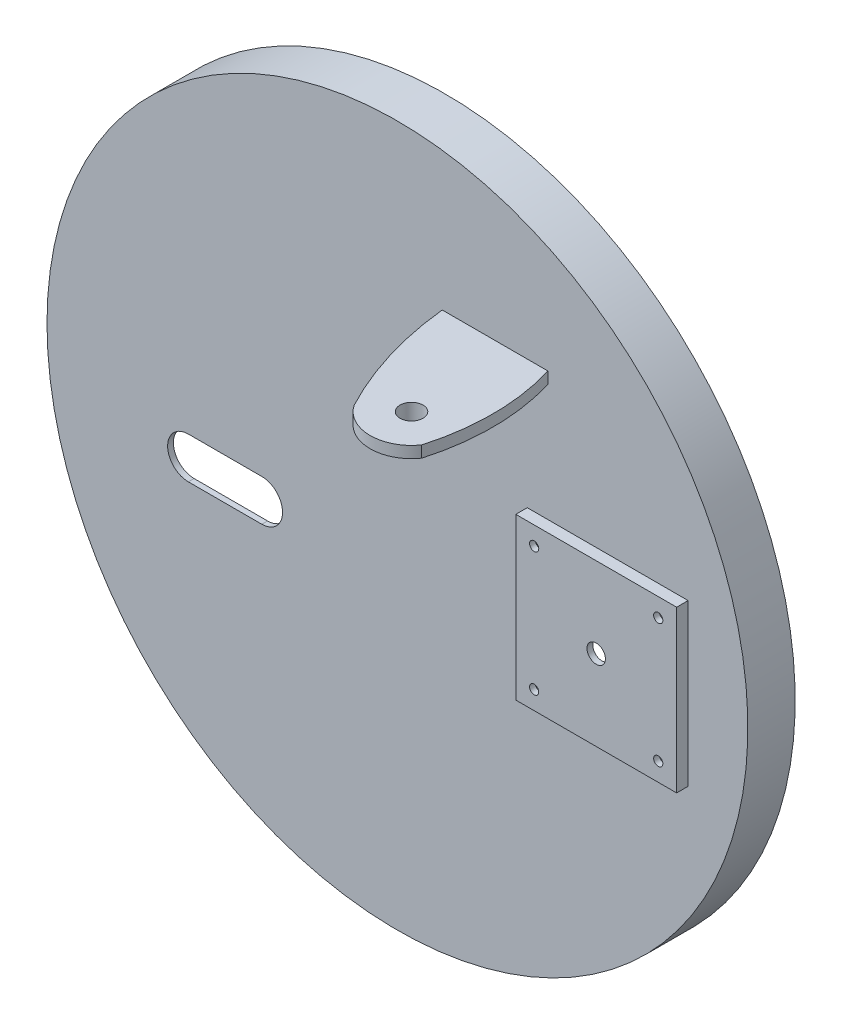
from build123d import *

# Parameters (mm, degrees)
SKETCH_1_R           = 305
EXTRUDE_1_DEPTH      = 41.2
SKETCH_2_W           = 140
SKETCH_2_H           = 140
EXTRUDE_2_DEPTH      = 10
SHELL_1_T            = -5
CUT_EXTRUDE_9_DEPTH  = 100
SKETCH_5_W           = 120
SKETCH_5_H           = 10
EXTRUDE_3_DEPTH      = 150
CUT_EXTRUDE_10_DEPTH = 150
SKETCH_10_R          = 10
CUT_EXTRUDE_11_DEPTH = 150
EXTRUDE_START        = 10
SKETCH_11_R          = 20
SKETCH_11_R_2        = 10
EXTRUDE_4_DEPTH      = 10
SKETCH_18_R          = 85
EXTRUDE_7_DEPTH      = 30
SKETCH_19_R          = 75
CUT_EXTRUDE_12_DEPTH = 30
SKETCH_21_R          = 4
SKETCH_21_R_2        = 8
CUT_EXTRUDE_13_DEPTH = 30


with BuildPart() as part:
    # 草图1 → 凸台-拉伸1 (new body)
    with BuildSketch(Plane.XY):
        Circle(SKETCH_1_R)
    extrude(amount=EXTRUDE_1_DEPTH)

    # 草图2 → 凸台-拉伸2 (add)
    with BuildSketch(Plane.XY.offset(41.2)):
        with Locations((183, 0)):
            Rectangle(SKETCH_2_W, SKETCH_2_H)
    extrude(amount=EXTRUDE_2_DEPTH)

    # 抽壳1
    shell_1_openings = [part.faces().sort_by_distance(p)[0] for p in [
        (0, 0, 0),
    ]]
    offset(amount=SHELL_1_T, openings=shell_1_openings, kind=Kind.INTERSECTION)

    # 草图4 → 切除-拉伸9 (cut)
    with BuildSketch(Plane.XY):
        with BuildLine():
            Line((-182, -22), (-118, -22))
            ThreePointArc((-118, -22), (-100, -40), (-118, -58))
            Line((-118, -58), (-182, -58))
            ThreePointArc((-182, -58), (-200, -40), (-182, -22))
        make_face()
    extrude(amount=CUT_EXTRUDE_9_DEPTH, mode=Mode.SUBTRACT)

    # 草图5 → 凸台-拉伸3 (add)
    with BuildSketch(Plane.XY.offset(41.2)):
        with Locations((99, 177.019414693)):
            Rectangle(SKETCH_5_W, SKETCH_5_H)
    extrude(amount=EXTRUDE_3_DEPTH)

    # 草图9 → 切除-拉伸10 (cut)
    with BuildSketch(Plane.XZ.offset(-172.019414693)):
        with BuildLine():
            Line((159, 191.2), (39, 191.2))
            Line((39, 191.2), (39, 41.2))
            ThreePointArc((39, 41.2), (50.403223503, 97.919506773), (72.48168386, 151.395459716))
            ThreePointArc((72.48168386, 151.395459716), (95.641745104, 166.582031742), (122.732592827, 160.828217675))
            ThreePointArc((122.732592827, 160.828217675), (127.644425669, 156.750329387), (131.758731658, 151.868960626))
            ThreePointArc((131.758731658, 151.868960626), (139.395350951, 96.479523786), (131, 41.2))
            Line((131, 41.2), (159, 41.2))
            Line((159, 41.2), (159, 191.2))
        make_face()
    extrude(amount=-CUT_EXTRUDE_10_DEPTH, mode=Mode.SUBTRACT)

    # 草图10 → 切除-拉伸11 (cut)
    with BuildSketch(Plane.XZ.offset(-172.019414693)):
        with Locations((102.283418824, 131.2)):
            Circle(SKETCH_10_R)
    extrude(amount=-CUT_EXTRUDE_11_DEPTH, mode=Mode.SUBTRACT)

    # 草图11 → 凸台-拉伸4 (add)
    with BuildSketch(Plane.XZ.offset(-172.019414693).offset(EXTRUDE_START)):
        with Locations((102.283418824, 131.2)):
            Circle(SKETCH_11_R)
        with Locations((102.283418824, 131.2)):
            Circle(SKETCH_11_R_2, mode=Mode.SUBTRACT)
    extrude(amount=-EXTRUDE_4_DEPTH)

    # 草图18 → 凸台-拉伸7 (add)
    with BuildSketch(Plane(origin=(0, 0, 36.2), x_dir=(-1, 0, 0), z_dir=(0, 0, -1))):
        Circle(SKETCH_18_R)
    extrude(amount=EXTRUDE_7_DEPTH)

    # 草图19 → 切除-拉伸12 (cut)
    with BuildSketch(Plane(origin=(0, 0, 6.2), x_dir=(-1, 0, 0), z_dir=(0, 0, -1))):
        Circle(SKETCH_19_R)
    extrude(amount=-CUT_EXTRUDE_12_DEPTH, mode=Mode.SUBTRACT)

    # 草图21 → 切除-拉伸13 (cut)
    with BuildSketch(Plane.XY.offset(51.2)):
        with Locations((237, 54)):
            Circle(SKETCH_21_R)
        with Locations((129, 54)):
            Circle(SKETCH_21_R)
        with Locations((237, -54)):
            Circle(SKETCH_21_R)
        with Locations((129, -54)):
            Circle(SKETCH_21_R)
        with Locations((183, 0)):
            Circle(SKETCH_21_R_2)
    extrude(amount=-CUT_EXTRUDE_13_DEPTH, mode=Mode.SUBTRACT)


solid = part.part
